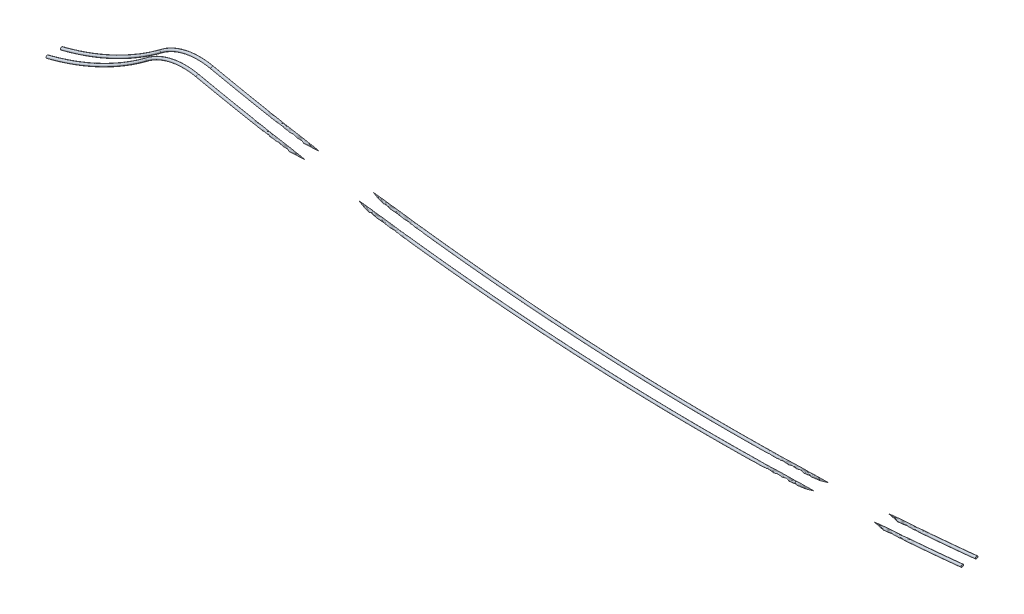
from build123d import *

# Parameters (mm, degrees)
SKETCH_2_R = 0.75


with BuildPart() as part:
    # 掃出1: sweep along a path in 草圖1
    with BuildLine(Plane.XY) as sweep_1_path:
        ThreePointArc((0, 0), (29.088698571, 10.472176423), (55.552361626, 26.456337375))
        ThreePointArc((55.552361626, 26.456337375), (68.858473811, 32.54018048), (83.489430625, 32.569694961))
        ThreePointArc((83.489430625, 32.569694961), (295.212935875, 4.207345549), (508.769754915, 9.182341102))
    # 草圖2 → 掃出1 (sweep)
    with BuildSketch(Plane(origin=(0, 0, 0), x_dir=(0, 0, -1), z_dir=(1, 0, 0))):
        with Locations((-4, 0)):
            Circle(SKETCH_2_R)
        with Locations((4, 0)):
            Circle(SKETCH_2_R)
    sweep(path=sweep_1_path.line)


solid = part.part
